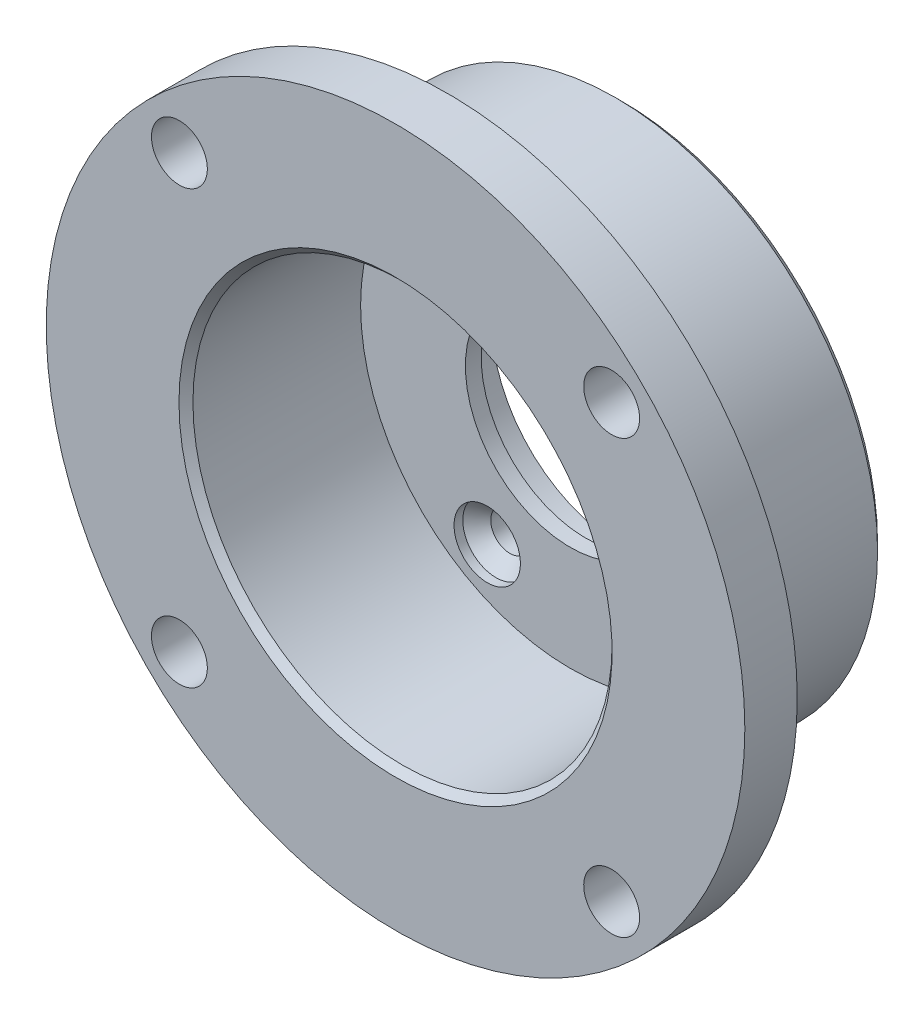
from build123d import *

# Parameters (mm, degrees)
CUT_EXTRUDE_1_REACH                = 32
SKETCH_2_R                         = 1.1
PATTERN_CIRCULAR_1_COUNT           = 2
PATTERN_CIRCULAR_1_ANGLE           = 60
SKETCH_3_R                         = 1.9
CUT_EXTRUDE_2_DEPTH                = 0.5
PATTERN_CIRCULAR_2_COUNT           = 2
PATTERN_CIRCULAR_2_ANGLE           = 60
SKETCH_4_R                         = 1.9
CUT_EXTRUDE_3_DEPTH                = 1.2
CUT_EXTRUDE_3_DRAFT                = -45
PATTERN_CIRCULAR_3_COPY_1_SKETCH_R = 1.9
PATTERN_CIRCULAR_3_COPY_1_DEPTH    = 1.2
PATTERN_CIRCULAR_3_COPY_1_DRAFT    = -45
PATTERN_CIRCULAR_3_COPY_2_SKETCH_R = 1.9
PATTERN_CIRCULAR_3_COPY_2_DEPTH    = 1.2
PATTERN_CIRCULAR_3_COPY_2_DRAFT    = -45
PATTERN_CIRCULAR_3_COPY_3_SKETCH_R = 1.9
PATTERN_CIRCULAR_3_COPY_3_DEPTH    = 1.2
PATTERN_CIRCULAR_3_COPY_3_DRAFT    = -45
PATTERN_CIRCULAR_3_COPY_4_SKETCH_R = 1.9
PATTERN_CIRCULAR_3_COPY_4_DEPTH    = 1.2
PATTERN_CIRCULAR_3_COPY_4_DRAFT    = -45
PATTERN_CIRCULAR_3_COPY_5_SKETCH_R = 1.9
PATTERN_CIRCULAR_3_COPY_5_DEPTH    = 1.2
PATTERN_CIRCULAR_3_COPY_5_DRAFT    = -45
CUT_EXTRUDE_4_REACH                = 33.129
SKETCH_5_R                         = 1.6
PATTERN_CIRCULAR_4_COUNT           = 4
CHAMFER_1_SIZE                     = 0.4


with BuildPart() as part:
    # Эскиз1 → Повернуть1 (revolve)
    with BuildSketch(Plane(origin=(0, 0, 0), x_dir=(1, 0, 0), z_dir=(0, 1, 0))):
        Polygon((-20, 0), (-20, 3), (-15, 3), (-15, 13), (-7.5, 13), (-7.5, 10.9), (-6, 10.9), (-6, 10), (-12, 10), (-12, 0), align=None)
    revolve(axis=Axis((0, 0, 0), (0, 0, -1)))

    # Эскиз2 → Вырез-Вытянуть1 (cut, up to next)
    with BuildSketch(Plane.XY.offset(-10), mode=Mode.PRIVATE) as cut_extrude_1_sk1:
        with Locations((4.75, 8.227241336)):
            Circle(SKETCH_2_R)
    cut_extrude_1_tool1 = extrude(cut_extrude_1_sk1.sketch, amount=-CUT_EXTRUDE_1_REACH, mode=Mode.PRIVATE) & part.part
    # Эскиз2 → Вырез-Вытянуть1 (cut, up to next)
    with BuildSketch(Plane.XY.offset(-10), mode=Mode.PRIVATE) as cut_extrude_1_sk2:
        with Locations((-4.75, -8.227241336)):
            Circle(SKETCH_2_R)
    cut_extrude_1_tool2 = extrude(cut_extrude_1_sk2.sketch, amount=-CUT_EXTRUDE_1_REACH, mode=Mode.PRIVATE) & part.part
    cut_extrude_1_1 = cut_extrude_1_tool1.solids().sort_by_distance((4.75, 8.227241, -10))[0]
    add(cut_extrude_1_1, mode=Mode.SUBTRACT)
    cut_extrude_1_2 = cut_extrude_1_tool2.solids().sort_by_distance((-4.75, -8.227241, -10))[0]
    add(cut_extrude_1_2, mode=Mode.SUBTRACT)
    cut_extrude_1 = cut_extrude_1_1 + cut_extrude_1_2  # Вырез-Вытянуть1 as one shape, for the pattern or mirror that repeats it

    # Круговой массив1: Вырез-Вытянуть1 ×2 about axis
    pattern_circular_1_axis = Axis((0, 0, 0), (0, 0, 1))
    for i in range(1, PATTERN_CIRCULAR_1_COUNT):
        add(cut_extrude_1.rotate(pattern_circular_1_axis, i * PATTERN_CIRCULAR_1_ANGLE / (PATTERN_CIRCULAR_1_COUNT - 1)), mode=Mode.SUBTRACT)

    # Эскиз3 → Вырез-Вытянуть2 (cut)
    with BuildSketch(Plane.XY.offset(-10)):
        with Locations((4.75, 8.227241336)):
            Circle(SKETCH_3_R)
        with Locations((-4.75, -8.227241336)):
            Circle(SKETCH_3_R)
    cut_extrude_2 = extrude(amount=-CUT_EXTRUDE_2_DEPTH, mode=Mode.SUBTRACT)

    # Круговой массив2: Вырез-Вытянуть2 ×2 about axis
    pattern_circular_2_axis = Axis((0, 0, 0), (0, 0, 1))
    for i in range(1, PATTERN_CIRCULAR_2_COUNT):
        add(cut_extrude_2.rotate(pattern_circular_2_axis, i * PATTERN_CIRCULAR_2_ANGLE / (PATTERN_CIRCULAR_2_COUNT - 1)), mode=Mode.SUBTRACT)


with BuildPart() as cut_extrude_3_tool:
    # Эскиз4 → Вырез-Вытянуть3 (with draft: the straight prism first)
    with BuildSketch(Plane.XY.offset(-10.5)):
        with Locations((4.75, 8.227241336)):
            Circle(SKETCH_4_R)
    extrude(amount=-CUT_EXTRUDE_3_DEPTH)
    # Вырез-Вытянуть3: the draft: its side faces are tilted about the plane it starts from
    cut_extrude_3_sides = [cut_extrude_3_tool.faces().sort_by_distance(p)[0] for p in [
        (2.85, 8.227241336, -11.1),
    ]]
    draft(cut_extrude_3_sides, Plane.XY.offset(-10.5), CUT_EXTRUDE_3_DRAFT)


with BuildPart() as part_1:
    add(part.part)

    # Вырез-Вытянуть3: cut by cut_extrude_3_tool
    add(cut_extrude_3_tool.part, mode=Mode.SUBTRACT)


with BuildPart() as pattern_circular_3_copy_1_tool:
    # Круговой массив3 copy 1 sketch → Круговой массив3 copy 1 (with draft: the straight prism first)
    with BuildSketch(Plane(origin=(0, 0, -10.5), x_dir=(0.5000000000000001, 0.8660254037844386, 0), z_dir=(0, 0, 1))):
        with Locations((4.75, 8.227241336)):
            Circle(PATTERN_CIRCULAR_3_COPY_1_SKETCH_R)
    extrude(amount=-PATTERN_CIRCULAR_3_COPY_1_DEPTH)
    # Круговой массив3 copy 1: the draft: its side faces are tilted about the plane it starts from
    pattern_circular_3_copy_1_sides = [pattern_circular_3_copy_1_tool.faces().sort_by_distance(p)[0] for p in [
        (-5.7, 6.581793069, -11.1),
    ]]
    draft(pattern_circular_3_copy_1_sides, Plane(origin=(0, 0, -10.5), x_dir=(0.5000000000000001, 0.8660254037844386, 0), z_dir=(0, 0, 1)), PATTERN_CIRCULAR_3_COPY_1_DRAFT)


with BuildPart() as part_2:
    add(part_1.part)

    # Круговой массив3 copy 1: cut by pattern_circular_3_copy_1_tool
    add(pattern_circular_3_copy_1_tool.part, mode=Mode.SUBTRACT)


with BuildPart() as pattern_circular_3_copy_2_tool:
    # Круговой массив3 copy 2 sketch → Круговой массив3 copy 2 (with draft: the straight prism first)
    with BuildSketch(Plane(origin=(0, 0, -10.5), x_dir=(-0.4999999999999998, 0.8660254037844387, 0), z_dir=(0, 0, 1))):
        with Locations((4.75, 8.227241336)):
            Circle(PATTERN_CIRCULAR_3_COPY_2_SKETCH_R)
    extrude(amount=-PATTERN_CIRCULAR_3_COPY_2_DEPTH)
    # Круговой массив3 copy 2: the draft: its side faces are tilted about the plane it starts from
    pattern_circular_3_copy_2_sides = [pattern_circular_3_copy_2_tool.faces().sort_by_distance(p)[0] for p in [
        (-8.55, -1.645448267, -11.1),
    ]]
    draft(pattern_circular_3_copy_2_sides, Plane(origin=(0, 0, -10.5), x_dir=(-0.4999999999999998, 0.8660254037844387, 0), z_dir=(0, 0, 1)), PATTERN_CIRCULAR_3_COPY_2_DRAFT)


with BuildPart() as part_3:
    add(part_2.part)

    # Круговой массив3 copy 2: cut by pattern_circular_3_copy_2_tool
    add(pattern_circular_3_copy_2_tool.part, mode=Mode.SUBTRACT)


with BuildPart() as pattern_circular_3_copy_3_tool:
    # Круговой массив3 copy 3 sketch → Круговой массив3 copy 3 (with draft: the straight prism first)
    with BuildSketch(Plane(origin=(0, 0, -10.5), x_dir=(-1, 0, 0), z_dir=(0, 0, 1))):
        with Locations((4.75, 8.227241336)):
            Circle(PATTERN_CIRCULAR_3_COPY_3_SKETCH_R)
    extrude(amount=-PATTERN_CIRCULAR_3_COPY_3_DEPTH)
    # Круговой массив3 copy 3: the draft: its side faces are tilted about the plane it starts from
    pattern_circular_3_copy_3_sides = [pattern_circular_3_copy_3_tool.faces().sort_by_distance(p)[0] for p in [
        (-2.85, -8.227241336, -11.1),
    ]]
    draft(pattern_circular_3_copy_3_sides, Plane(origin=(0, 0, -10.5), x_dir=(-1, 0, 0), z_dir=(0, 0, 1)), PATTERN_CIRCULAR_3_COPY_3_DRAFT)


with BuildPart() as part_4:
    add(part_3.part)

    # Круговой массив3 copy 3: cut by pattern_circular_3_copy_3_tool
    add(pattern_circular_3_copy_3_tool.part, mode=Mode.SUBTRACT)


with BuildPart() as pattern_circular_3_copy_4_tool:
    # Круговой массив3 copy 4 sketch → Круговой массив3 copy 4 (with draft: the straight prism first)
    with BuildSketch(Plane(origin=(0, 0, -10.5), x_dir=(-0.5000000000000004, -0.8660254037844384, 0), z_dir=(0, 0, 1))):
        with Locations((4.75, 8.227241336)):
            Circle(PATTERN_CIRCULAR_3_COPY_4_SKETCH_R)
    extrude(amount=-PATTERN_CIRCULAR_3_COPY_4_DEPTH)
    # Круговой массив3 copy 4: the draft: its side faces are tilted about the plane it starts from
    pattern_circular_3_copy_4_sides = [pattern_circular_3_copy_4_tool.faces().sort_by_distance(p)[0] for p in [
        (5.7, -6.581793069, -11.1),
    ]]
    draft(pattern_circular_3_copy_4_sides, Plane(origin=(0, 0, -10.5), x_dir=(-0.5000000000000004, -0.8660254037844384, 0), z_dir=(0, 0, 1)), PATTERN_CIRCULAR_3_COPY_4_DRAFT)


with BuildPart() as part_5:
    add(part_4.part)

    # Круговой массив3 copy 4: cut by pattern_circular_3_copy_4_tool
    add(pattern_circular_3_copy_4_tool.part, mode=Mode.SUBTRACT)


with BuildPart() as pattern_circular_3_copy_5_tool:
    # Круговой массив3 copy 5 sketch → Круговой массив3 copy 5 (with draft: the straight prism first)
    with BuildSketch(Plane(origin=(0, 0, -10.5), x_dir=(0.5000000000000001, -0.8660254037844386, 0), z_dir=(0, 0, 1))):
        with Locations((4.75, 8.227241336)):
            Circle(PATTERN_CIRCULAR_3_COPY_5_SKETCH_R)
    extrude(amount=-PATTERN_CIRCULAR_3_COPY_5_DEPTH)
    # Круговой массив3 copy 5: the draft: its side faces are tilted about the plane it starts from
    pattern_circular_3_copy_5_sides = [pattern_circular_3_copy_5_tool.faces().sort_by_distance(p)[0] for p in [
        (8.55, 1.645448267, -11.1),
    ]]
    draft(pattern_circular_3_copy_5_sides, Plane(origin=(0, 0, -10.5), x_dir=(0.5000000000000001, -0.8660254037844386, 0), z_dir=(0, 0, 1)), PATTERN_CIRCULAR_3_COPY_5_DRAFT)


with BuildPart() as part_6:
    add(part_5.part)

    # Круговой массив3 copy 5: cut by pattern_circular_3_copy_5_tool
    add(pattern_circular_3_copy_5_tool.part, mode=Mode.SUBTRACT)

    # Эскиз5 → Вырез-Вытянуть4 (cut, up to next)
    with BuildSketch(Plane.XY, mode=Mode.PRIVATE) as cut_extrude_4_sk1:
        with Locations((12.374368671, 12.374368671)):
            Circle(SKETCH_5_R)
    cut_extrude_4_tool1 = extrude(cut_extrude_4_sk1.sketch, amount=-CUT_EXTRUDE_4_REACH, mode=Mode.PRIVATE) & part_6.part
    cut_extrude_4 = cut_extrude_4_tool1.solids().sort_by_distance((12.374369, 12.374369, 0))[0]
    add(cut_extrude_4, mode=Mode.SUBTRACT)

    # Круговой массив4: Вырез-Вытянуть4 ×4 about axis
    pattern_circular_4_axis = Axis((0, 0, 0), (0, 0, 1))
    for i in range(1, PATTERN_CIRCULAR_4_COUNT):
        add(cut_extrude_4.rotate(pattern_circular_4_axis, i * 360 / PATTERN_CIRCULAR_4_COUNT), mode=Mode.SUBTRACT)

    # Фаска1
    chamfer_1_edges = [part_6.edges().sort_by_distance(p)[0] for p in [
        (15, 0, -13),
        (12, 0, 0),
    ]]
    chamfer(chamfer_1_edges, length=CHAMFER_1_SIZE)


solid = part_6.part
